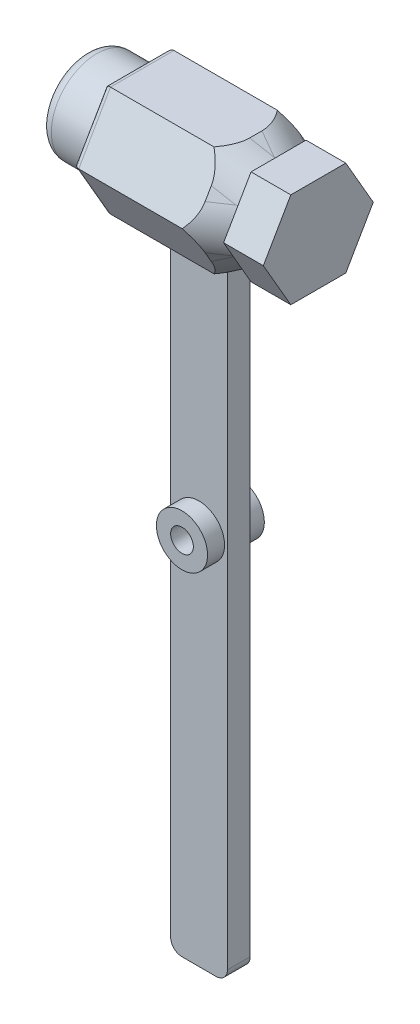
from build123d import *
from OCP.BRepFilletAPI import BRepFilletAPI_MakeChamfer

# Parameters (mm, degrees)
SKETCH1_R                = 4.5
SKETCH1_R_2              = 2
BOSS_EXTRUDE1_DEPTH      = 2
SKETCH1_3_R              = 4.5
SKETCH1_3_R_2            = 2
BOSS_EXTRUDE2_DEPTH      = 5
SKETCH2_R                = 8
BOSS_EXTRUDE3_DEPTH      = 17
BOSS_EXTRUDE5_DEPTH      = 20
BOSS_EXTRUDE5_DEPTH_BACK = 8
SKETCH2_4_R              = 8
FILLET3_R                = 1
FILLET4_R                = 2
CHAMFER1_SIZE            = 7
CHAMFER1_SIZE2           = 4.041451884
FILLET5_R                = 9
BOSS_EXTRUDE6_DEPTH      = 4
BOSS_EXTRUDE6_DEPTH_BACK = 3
BOSS_EXTRUDE6_START      = 20
SKETCH2_7_R              = 8


with BuildPart() as part:
    # Sketch1 → Boss-Extrude1 (new, symmetric)
    # profile 1 of 2: a face of its own
    with BuildSketch(Plane.XY):
        with BuildLine():
            Line((10, 110.5), (0, 110.5))
            Line((0, 110.5), (0, 2))
            ThreePointArc((0, 2), (0.585786438, 0.585786438), (2, 0))
            Line((2, 0), (8, 0))
            ThreePointArc((8, 0), (9.414213562, 0.585786438), (10, 2))
            Line((10, 2), (10, 110.5))
        make_face()
        with Locations((5, 66.5)):
            Circle(SKETCH1_R, mode=Mode.SUBTRACT)
    # profile 2 of 2: a face of its own
    with BuildSketch(Plane.XY):
        with Locations((5, 66.5)):
            Circle(SKETCH1_R)
        with Locations((5, 66.5)):
            Circle(SKETCH1_R_2, mode=Mode.SUBTRACT)
    extrude(amount=BOSS_EXTRUDE1_DEPTH, both=True)

    # Sketch1<3> → Boss-Extrude2 (add, symmetric)
    with BuildSketch(Plane.XY):
        with Locations((5, 66.5)):
            Circle(SKETCH1_3_R)
        with Locations((5, 66.5)):
            Circle(SKETCH1_3_R_2, mode=Mode.SUBTRACT)
    extrude(amount=BOSS_EXTRUDE2_DEPTH, both=True)


with BuildPart() as body_2:
    # Sketch2 → Boss-Extrude3 (new body)
    with BuildSketch(Plane(origin=(0, 0, 0), x_dir=(0, 0, -1), z_dir=(1, 0, 0))):
        with Locations((0, 120.20217709)):
            Circle(SKETCH2_R)
    extrude(amount=-BOSS_EXTRUDE3_DEPTH)

    # Sketch2<4> → Boss-Extrude5 (add, two sides: drawn at the far end of the back side and taken through both)
    # profile 1 of 3: a face of its own
    with BuildSketch(Plane(origin=(0, 0, 0), x_dir=(0, 0, -1), z_dir=(1, 0, 0)).offset(-BOSS_EXTRUDE5_DEPTH_BACK)):
        Polygon((5.587548937, 129.880095739), (-5.587548937, 129.880095739), (-11.175097875, 120.20217709), (-5.587548937, 110.524258441), (5.587548937, 110.524258441), (11.175097875, 120.20217709), align=None)
        with Locations((0, 120.20217709)):
            Circle(SKETCH2_4_R, mode=Mode.SUBTRACT)
    # profile 2 of 3: a face of its own
    with BuildSketch(Plane(origin=(0, 0, 0), x_dir=(0, 0, -1), z_dir=(1, 0, 0)).offset(-BOSS_EXTRUDE5_DEPTH_BACK)):
        Polygon((-4.838959325, 111.820853684), (4.838959325, 111.820853684), (9.677918649, 120.20217709), (4.838959325, 128.583500496), (-4.838959325, 128.583500496), (-9.677918649, 120.20217709), align=None)
        with Locations((0, 120.20217709)):
            Circle(SKETCH2_4_R, mode=Mode.SUBTRACT)
    # profile 3 of 3: a face of its own
    with BuildSketch(Plane(origin=(0, 0, 0), x_dir=(0, 0, -1), z_dir=(1, 0, 0)).offset(-BOSS_EXTRUDE5_DEPTH_BACK)):
        with Locations((0, 120.20217709)):
            Circle(SKETCH2_4_R)
    extrude(amount=BOSS_EXTRUDE5_DEPTH + BOSS_EXTRUDE5_DEPTH_BACK)

    # Fillet3
    fillet3_edges = [body_2.edges().sort_by_distance(p)[0] for p in [
        (-8, 129.880095739, 0),
        (-8, 125.041136415, -8.381323406),
        (-8, 115.363217765, -8.381323406),
        (-8, 110.524258441, 0),
        (-8, 115.363217765, 8.381323406),
        (-8, 125.041136415, 8.381323406),
    ]]
    fillet(fillet3_edges, radius=FILLET3_R)

    # Fillet4
    fillet4_edges = [body_2.edges().sort_by_distance(p)[0] for p in [
        (-17, 120.20217709, 8),
    ]]
    fillet(fillet4_edges, radius=FILLET4_R)

    # Chamfer1: one chamfer whose edges measure the first distance from different faces: ONE call of the kernel's chamfer builder (chamfer() names one face for all edges)
    chamfer1_edges_1 = [body_2.edges().sort_by_distance(p)[0] for p in [
        (20, 110.524258441, 0),
    ]]
    chamfer1_side_1 = [body_2.faces().sort_by_distance(p)[0] for p in [
        (6.5, 110.524258441, 0),
    ]]
    chamfer1_edges_2 = [body_2.edges().sort_by_distance(p)[0] for p in [
        (20, 115.363217765, -8.381323406),
    ]]
    chamfer1_side_2 = [body_2.faces().sort_by_distance(p)[0] for p in [
        (6.5, 115.363217765, -8.381323406),
    ]]
    chamfer1_edges_3 = [body_2.edges().sort_by_distance(p)[0] for p in [
        (20, 125.041136415, -8.381323406),
    ]]
    chamfer1_side_3 = [body_2.faces().sort_by_distance(p)[0] for p in [
        (6.5, 125.041136415, -8.381323406),
    ]]
    chamfer1_edges_4 = [body_2.edges().sort_by_distance(p)[0] for p in [
        (20, 129.880095739, 0),
    ]]
    chamfer1_side_4 = [body_2.faces().sort_by_distance(p)[0] for p in [
        (6.5, 129.880095739, 0),
    ]]
    chamfer1_edges_5 = [body_2.edges().sort_by_distance(p)[0] for p in [
        (20, 125.041136415, 8.381323406),
    ]]
    chamfer1_side_5 = [body_2.faces().sort_by_distance(p)[0] for p in [
        (6.5, 125.041136415, 8.381323406),
    ]]
    chamfer1_edges_6 = [body_2.edges().sort_by_distance(p)[0] for p in [
        (20, 115.363217765, 8.381323406),
    ]]
    chamfer1_side_6 = [body_2.faces().sort_by_distance(p)[0] for p in [
        (6.5, 115.363217765, 8.381323406),
    ]]
    chamfer1 = BRepFilletAPI_MakeChamfer(body_2.part.solid().wrapped)
    for e in chamfer1_edges_1:
        chamfer1.Add(CHAMFER1_SIZE, CHAMFER1_SIZE2, e.wrapped, chamfer1_side_1[0].wrapped)  # the first distance lies on this face
    for e in chamfer1_edges_2:
        chamfer1.Add(CHAMFER1_SIZE, CHAMFER1_SIZE2, e.wrapped, chamfer1_side_2[0].wrapped)  # the first distance lies on this face
    for e in chamfer1_edges_3:
        chamfer1.Add(CHAMFER1_SIZE, CHAMFER1_SIZE2, e.wrapped, chamfer1_side_3[0].wrapped)  # the first distance lies on this face
    for e in chamfer1_edges_4:
        chamfer1.Add(CHAMFER1_SIZE, CHAMFER1_SIZE2, e.wrapped, chamfer1_side_4[0].wrapped)  # the first distance lies on this face
    for e in chamfer1_edges_5:
        chamfer1.Add(CHAMFER1_SIZE, CHAMFER1_SIZE2, e.wrapped, chamfer1_side_5[0].wrapped)  # the first distance lies on this face
    for e in chamfer1_edges_6:
        chamfer1.Add(CHAMFER1_SIZE, CHAMFER1_SIZE2, e.wrapped, chamfer1_side_6[0].wrapped)  # the first distance lies on this face
    add(Compound.cast(chamfer1.Shape()), mode=Mode.REPLACE)

    # Fillet5
    # the kernel refuses this fillet: 9 mm, written as the material it takes off along each edge
    with BuildSketch(Plane(origin=(4.006659268, 120.20217709, 17.170658362), x_dir=(-0.2401922307076287, 0.9013878188660001, -0.36028834606144067), z_dir=(0.8320502943378434, 1.2088901500668617e-15, -0.5547001962252296)), Plane(origin=(4.006659268, 135.072403432, 8.585329181), x_dir=(-0.24019223070763052, 0.13867504905631706, -0.9607689228305214), z_dir=(0.8320502943378435, -0.48038446141525903, -0.27735009811261924))) as fillet5_piece_1:
        with BuildLine():
            CenterArc((FILLET5_R * 0.480384461415, -FILLET5_R), FILLET5_R, 90, 51.317812547)
            Line((-FILLET5_R * 0.300240288385, -FILLET5_R * 0.375), (0, 0))
            Line((0, 0), (FILLET5_R * 0.480384461415, 0))
        make_face()
    extrude(amount=30.03025374, mode=Mode.SUBTRACT)
    with BuildSketch(Plane(origin=(4.006659268, 105.331950748, 8.585329181), x_dir=(-0.24019223070763074, -0.13867504905630562, -0.9607689228305231), z_dir=(0.832050294337843, 0.48038446141526303, -0.27735009811261374)), Plane(origin=(4.006659268, 105.331950748, -8.585329181), x_dir=(-0.24019223070763016, 0.7627127698096926, -0.6004805767690735), z_dir=(0.8320502943378429, 0.4803844614152607, 0.2773500981126182)), Plane(origin=(4.006659268, 120.20217709, -17.170658362), x_dir=(-0.24019223070763193, 0.9013878188659946, 0.36028834606145216), z_dir=(0.8320502943378428, -3.413336894306415e-15, 0.5547001962252306)), Plane(origin=(4.006659268, 135.072403432, -8.585329181), x_dir=(-0.2401922307076317, 0.13867504905629685, 0.960768922830524), z_dir=(0.832050294337843, -0.48038446141526503, 0.27735009811261024))) as fillet5_piece_2:
        with BuildLine():
            CenterArc((FILLET5_R * 0.480384461415, FILLET5_R), FILLET5_R, 218.682187453, 51.317812547)
            Line((-FILLET5_R * 0.300240288385, FILLET5_R * 0.375), (0, 0))
            Line((0, 0), (FILLET5_R * 0.480384461415, 0))
        make_face()
    extrude(amount=30.03025374, mode=Mode.SUBTRACT)

    # Sketch2<7> → Boss-Extrude6 (add, two sides: drawn at the far end of the back side and taken through both)
    # profile 1 of 2: a face of its own
    with BuildSketch(Plane(origin=(0, 0, 0), x_dir=(0, 0, -1), z_dir=(1, 0, 0)).offset(BOSS_EXTRUDE6_START - BOSS_EXTRUDE6_DEPTH_BACK)):
        Polygon((-4.838959325, 111.820853684), (4.838959325, 111.820853684), (9.677918649, 120.20217709), (4.838959325, 128.583500496), (-4.838959325, 128.583500496), (-9.677918649, 120.20217709), align=None)
        with Locations((0, 120.20217709)):
            Circle(SKETCH2_7_R, mode=Mode.SUBTRACT)
    # profile 2 of 2: a face of its own
    with BuildSketch(Plane(origin=(0, 0, 0), x_dir=(0, 0, -1), z_dir=(1, 0, 0)).offset(BOSS_EXTRUDE6_START - BOSS_EXTRUDE6_DEPTH_BACK)):
        with Locations((0, 120.20217709)):
            Circle(SKETCH2_7_R)
    extrude(amount=BOSS_EXTRUDE6_DEPTH + BOSS_EXTRUDE6_DEPTH_BACK)


solid = Compound([part.part, body_2.part])
